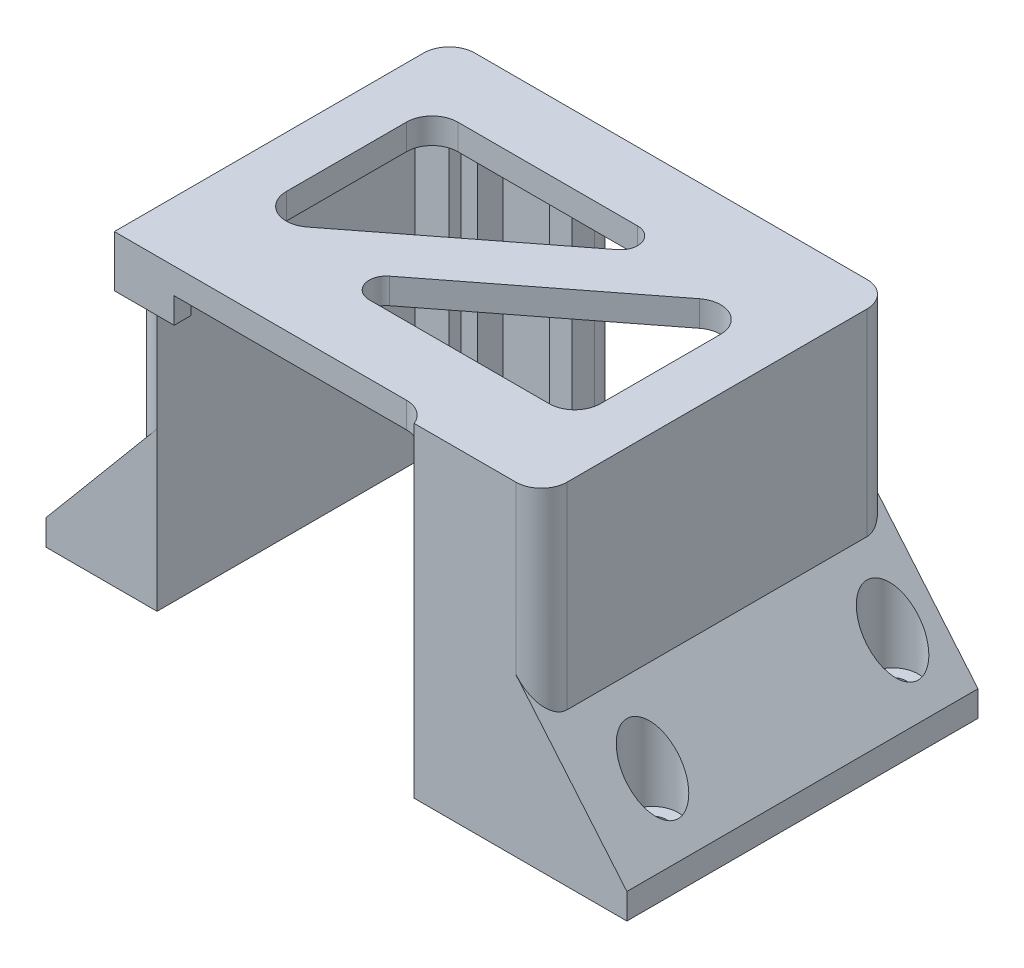
from build123d import *
from OCP.BRepFilletAPI import BRepFilletAPI_MakeFillet

# Parameters (mm, degrees)
SKETCH_1_W           = 71.9
SKETCH_1_H           = 40.1
SKETCH_1_W_2         = 4
SKETCH_1_H_2         = 1.4
SKETCH_1_H_3         = 0.9
EXTRUDE_1_DEPTH      = 35
SKETCH_4_W           = 8.4
SKETCH_4_H           = 4.4
SKETCH_4_W_2         = 30
SKETCH_4_H_2         = 2
CUT_EXTRUDE_2_DEPTH  = 77.710233998
SKETCH_5_W           = 71.9
SKETCH_5_H           = 40.1
EXTRUDE_2_DEPTH      = 3
SKETCH_6_W           = 47
SKETCH_6_H           = 0.9
CUT_EXTRUDE_3_DEPTH  = 79.124643999
SKETCH_7_R           = 1.6
CUT_EXTRUDE_4_DEPTH  = 79.124643999
SKETCH_10_W          = 10
SKETCH_10_H          = 39.2
SKETCH_10_H_2        = 40.1
CUT_EXTRUDE_6_DEPTH  = 35
CHAMFER_1_SIZE       = 10
CHAMFER_1_SIZE_2     = 11.917535926
SKETCH_8_R           = 3
CUT_EXTRUDE_5_DEPTH  = 35
SKETCH_11_W          = 17
SKETCH_11_H          = 32
CUT_EXTRUDE_7_DEPTH  = 2
CUT_EXTRUDE_8_DEPTH  = 79.124643999
FILLET_2_R1          = 2
FILLET_2_R2          = 3
SKETCH_13_W          = 24.9
SKETCH_13_H          = 1
EXTRUDE_3_DEPTH      = 38
SKETCH_14_W          = 11.9
SKETCH_14_H          = 1
CUT_EXTRUDE_9_DEPTH  = 35
CUT_EXTRUDE_10_REACH = 80.571
SKETCH_15_W          = 10
SKETCH_15_H          = 1
FILLET_3_R           = 3
FILLET_4_R           = 3
SKETCH_16_W          = 14.9
SKETCH_16_H          = 5.6
CUT_EXTRUDE_11_DEPTH = 35
FILLET_5_R           = 3


# Some blends are built 0.0001 mm under size
with BuildPart() as part:
    # 草图1 → 凸台-拉伸1 (new body)
    # profile 1 of 3: a face of its own
    with BuildSketch(Plane(origin=(0, 0, 0), x_dir=(1, 0, 0), z_dir=(0, 1, 0))):
        with Locations((22.95, -14.45)):
            Rectangle(SKETCH_1_W, SKETCH_1_H)
        Polygon((45.9, -32.5), (0, -32.5), (0, 0), (26.7, 0), (26.7, 2.6), (41.1, 2.6), (41.1, 0), (45.9, 0), align=None, mode=Mode.SUBTRACT)
    # profile 2 of 3: a face of its own
    with BuildSketch(Plane(origin=(0, 0, 0), x_dir=(1, 0, 0), z_dir=(0, 1, 0))):
        with Locations((2, -0.7)):
            Rectangle(SKETCH_1_W_2, SKETCH_1_H_2)
    # profile 3 of 3: a face of its own
    with BuildSketch(Plane(origin=(0, 0, 0), x_dir=(1, 0, 0), z_dir=(0, 1, 0))):
        with Locations((2, -32.05)):
            Rectangle(SKETCH_1_W_2, SKETCH_1_H_3)
    extrude(amount=EXTRUDE_1_DEPTH)

    # 草图4 → 切除-拉伸2 (cut, through all)
    with BuildSketch(Plane(origin=(0, 35, 0), x_dir=(1, 0, 0), z_dir=(0, 1, 0))):
        with Locations((10.12, 0.8)):
            Rectangle(SKETCH_4_W, SKETCH_4_H)
        with Locations((19, -33.5)):
            Rectangle(SKETCH_4_W_2, SKETCH_4_H_2)
    extrude(amount=-CUT_EXTRUDE_2_DEPTH, mode=Mode.SUBTRACT)

    # 草图5 → 凸台-拉伸2 (add)
    with BuildSketch(Plane(origin=(0, 35, 0), x_dir=(1, 0, 0), z_dir=(0, 1, 0))):
        with Locations((22.95, -14.45)):
            Rectangle(SKETCH_5_W, SKETCH_5_H)
    extrude(amount=EXTRUDE_2_DEPTH)

    # 草图6 → 切除-拉伸3 (cut, through all)
    with BuildSketch(Plane.XZ):
        with Locations((10.5, 34.05)):
            Rectangle(SKETCH_6_W, SKETCH_6_H)
    extrude(amount=-CUT_EXTRUDE_3_DEPTH, mode=Mode.SUBTRACT)

    # 草图7 → 切除-拉伸4 (cut, through all)
    with BuildSketch(Plane.XZ):
        with Locations(Location((-8, 27.5, 0), (0, 0, 270))):
            Circle(SKETCH_7_R)
        with Locations(Location((53.9, 27.5, 0), (0, 0, 270))):
            Circle(SKETCH_7_R)
        with Locations(Location((-8, -0.6, 0), (0, 0, 270))):
            Circle(SKETCH_7_R)
        with Locations(Location((53.9, -0.6, 0), (0, 0, 270))):
            Circle(SKETCH_7_R)
    extrude(amount=-CUT_EXTRUDE_4_DEPTH, mode=Mode.SUBTRACT)

    # 草图10 → 切除-拉伸6 (cut)
    with BuildSketch(Plane(origin=(0, 38, 0), x_dir=(1, 0, 0), z_dir=(0, 1, 0))):
        with Locations((-8, -14)):
            Rectangle(SKETCH_10_W, SKETCH_10_H)
        with Locations((53.9, -14.45)):
            Rectangle(SKETCH_10_W, SKETCH_10_H_2)
    extrude(amount=-CUT_EXTRUDE_6_DEPTH, mode=Mode.SUBTRACT)

    # 倒角1
    # the kernel refuses this chamfer: 11.917535926, 10 mm, written as the material it adds along each edge
    with BuildSketch(Plane(origin=(48.9, 3, -5.6), x_dir=(0.9993728857116146, -0.03540953691366307, 0), z_dir=(0, 0, 1))) as chamfer_1_piece_1_section:
        Polygon((CHAMFER_1_SIZE * 0.999372885712, CHAMFER_1_SIZE * 0.0354095369137), (-CHAMFER_1_SIZE_2 * 0.0354095369135, CHAMFER_1_SIZE_2 * 0.999372885707), (0, 0), align=None)
    chamfer_1_piece_1 = extrude(amount=40.1, mode=Mode.PRIVATE)
    chamfer_1_piece_1 = split(chamfer_1_piece_1, bisect_by=Plane(origin=(58.9, 6.996958781, 14.489120948), z_dir=(-1, 0, 0)), keep=Keep.TOP, mode=Mode.PRIVATE)
    chamfer_1_piece_1 = chamfer_1_piece_1 - Plane(origin=(53.9, 6.996958781, 27.5), x_dir=(0, 0, -1), z_dir=(0, -1, 0)) * Cylinder(1.6, 128, mode=Mode.PRIVATE)
    chamfer_1_piece_1 = chamfer_1_piece_1 - Plane(origin=(53.9, 6.996958781, -0.6), x_dir=(0, 0, -1), z_dir=(0, -1, 0)) * Cylinder(1.6, 128, mode=Mode.PRIVATE)
    add(chamfer_1_piece_1)
    with BuildSketch(Plane(origin=(-3, 3, -5.6), x_dir=(-0.9993728857116146, -0.03540953691366305, 0), z_dir=(0, 0, 1))) as chamfer_1_piece_2_section:
        Polygon((CHAMFER_1_SIZE * 0.999372885712, -CHAMFER_1_SIZE * 0.0354095369137), (-CHAMFER_1_SIZE_2 * 0.0354095369135, -CHAMFER_1_SIZE_2 * 0.999372885707), (0, 0), align=None)
    chamfer_1_piece_2 = extrude(amount=39.2, mode=Mode.PRIVATE)
    chamfer_1_piece_2 = split(chamfer_1_piece_2, bisect_by=Plane(origin=(-13, 6.997914765, 14.022030522), z_dir=(1, 0, 0)), keep=Keep.TOP, mode=Mode.PRIVATE)
    chamfer_1_piece_2 = chamfer_1_piece_2 - Plane(origin=(-8, 6.997914765, 27.5), x_dir=(0, 0, -1), z_dir=(0, -1, 0)) * Cylinder(1.6, 127, mode=Mode.PRIVATE)
    chamfer_1_piece_2 = chamfer_1_piece_2 - Plane(origin=(-8, 6.997914765, -0.6), x_dir=(0, 0, -1), z_dir=(0, -1, 0)) * Cylinder(1.6, 127, mode=Mode.PRIVATE)
    add(chamfer_1_piece_2)

    # 草图8 → 切除-拉伸5 (cut)
    with BuildSketch(Plane(origin=(0, 38, 0), x_dir=(1, 0, 0), z_dir=(0, 1, 0))):
        with Locations(Location((-8, 0.6, 0), (0, 0, 270))):
            Circle(SKETCH_8_R)
        with Locations(Location((53.9, 0.6, 0), (0, 0, 270))):
            Circle(SKETCH_8_R)
        with Locations(Location((53.9, -27.5, 0), (0, 0, 270))):
            Circle(SKETCH_8_R)
        with Locations(Location((-8, -27.5, 0), (0, 0, 270))):
            Circle(SKETCH_8_R)
    extrude(amount=-CUT_EXTRUDE_5_DEPTH, mode=Mode.SUBTRACT)

    # 草图11 → 切除-拉伸7 (cut)
    with BuildSketch(Plane.XY.offset(33.6)):
        with Locations((-4.5, 16)):
            Rectangle(SKETCH_11_W, SKETCH_11_H)
    extrude(amount=-CUT_EXTRUDE_7_DEPTH, mode=Mode.SUBTRACT)

    # 草图12 → 切除-拉伸8 (cut, through all)
    with BuildSketch(Plane(origin=(0, 38, 0), x_dir=(1, 0, 0), z_dir=(0, 1, 0))):
        Polygon((3, -2.4), (3, -25.6), (32.9, -2.4), align=None)
        Polygon((42.9, -2.4), (13, -25.6), (42.9, -25.6), align=None)
    extrude(amount=-CUT_EXTRUDE_8_DEPTH, mode=Mode.SUBTRACT)

    # 圆角2: one fillet with a radius per group of edges: ONE call of the kernel's fillet builder (fillet() takes one radius for all edges)
    fillet_2_edges_1 = [part.edges().sort_by_distance(p)[0] for p in [
        (13, 36.5, 25.6),
        (32.9, 36.5, 2.4),
    ]]
    fillet_2_edges_2 = [part.edges().sort_by_distance(p)[0] for p in [
        (3, 36.5, 25.6),
        (42.9, 36.5, 25.6),
        (42.9, 36.5, 2.4),
        (3, 36.5, 2.4),
    ]]
    fillet_2 = BRepFilletAPI_MakeFillet(part.part.solid().wrapped)
    for e in fillet_2_edges_1:
        fillet_2.Add(FILLET_2_R1, e.wrapped)
    for e in fillet_2_edges_2:
        fillet_2.Add(FILLET_2_R2, e.wrapped)
    add(Compound.cast(fillet_2.Shape()), mode=Mode.REPLACE)

    # 草图13 → 凸台-拉伸3 (add)
    with BuildSketch(Plane.XZ):
        with Locations((46.45, 35)):
            Rectangle(SKETCH_13_W, SKETCH_13_H)
    extrude(amount=-EXTRUDE_3_DEPTH)

    # 草图14 → 切除-拉伸9 (cut)
    with BuildSketch(Plane.XZ):
        with Locations((39.95, 33)):
            Rectangle(SKETCH_14_W, SKETCH_14_H)
    extrude(amount=-CUT_EXTRUDE_9_DEPTH, mode=Mode.SUBTRACT)

    # 切除-拉伸10: up to this face of the body (flat: up to its plane)
    cut_extrude_10_end = Plane(part.part.faces().sort_by_distance((53.9, 8.958767963, 14.614170269))[0])
    # 草图15 → 切除-拉伸10 (cut, up to the picked face)
    with BuildSketch(Plane(origin=(0, 38, 0), x_dir=(1, 0, 0), z_dir=(0, 1, 0)), mode=Mode.PRIVATE) as cut_extrude_10_sk1:
        with Locations((53.9, -35)):
            Rectangle(SKETCH_15_W, SKETCH_15_H)
    cut_extrude_10_tool1 = split(extrude(cut_extrude_10_sk1.sketch, amount=-CUT_EXTRUDE_10_REACH, mode=Mode.PRIVATE), bisect_by=cut_extrude_10_end, keep=Keep.BOTH, mode=Mode.PRIVATE)
    add(cut_extrude_10_tool1.solids().sort_by(Axis((53.9, 38, 35), (0, -1, 0)))[0], mode=Mode.SUBTRACT)

    # 圆角3
    fillet_3_edges = [part.edges().sort_by_distance(p)[0] for p in [
        (-3, 26.458767963, -5.6),
        (48.9, 26.458767963, -5.6),
        (48.9, 26.458767963, 35.5),
        (-3, 23.458767963, 31.6),
    ]]
    fillet(fillet_3_edges, radius=FILLET_3_R - 0.0001)  # a hair under: the kernel refuses the full size

    # 圆角4
    # the kernel refuses this fillet: 3 mm, written as the material it adds along each edge
    with BuildSketch(Plane(origin=(34, 35, 33.6), x_dir=(0, 0, 1), z_dir=(0, 1, 0))) as fillet_4_piece_1:
        with BuildLine():
            CenterArc((3, -2.791057147), FILLET_4_R, 111.510188267, 68.489811733)
            Line((0, -2.791057147), (-0.06, -2.791057147))
            Line((-0.06, -2.791057147), (-0.06, 0))
            Line((-0.06, 0), (0, 0.06))
            ThreePointArc((0, 0.06), (0.95, 0.06), (1.878, 0.055821143))
            Line((1.878, 0.055821143), (1.9, 0))
        make_face()
    extrude(amount=3)

    # 草图16 → 切除-拉伸11 (cut)
    with BuildSketch(Plane.XZ):
        with Locations((24.45, -2.8)):
            Rectangle(SKETCH_16_W, SKETCH_16_H)
    extrude(amount=-CUT_EXTRUDE_11_DEPTH, mode=Mode.SUBTRACT)

    # 圆角5
    fillet_5_edges = [part.edges().sort_by_distance(p)[0] for p in [
        (31.9, 17.5, -5.6),
        (17, 17.5, -5.6),
    ]]
    fillet(fillet_5_edges, radius=FILLET_5_R - 0.0001)  # a hair under: the kernel refuses the full size


solid = part.part
